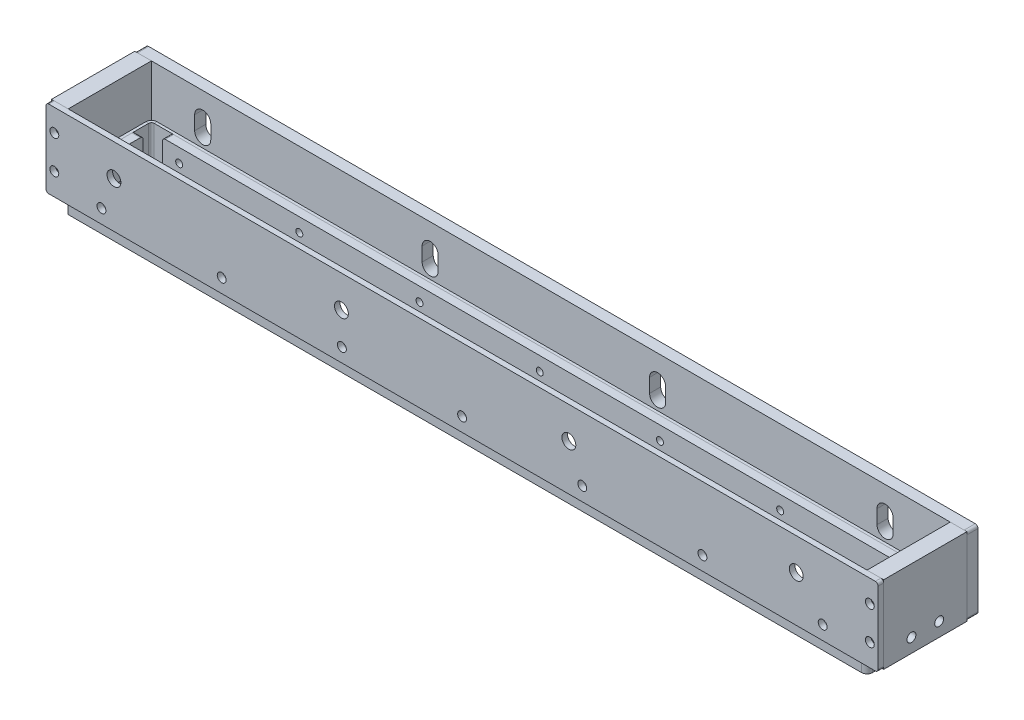
from build123d import *

# Parameters (mm, degrees)
SKETCH1_W                     = 300
SKETCH1_H                     = 36
SKETCH1_W_2                   = 288
SKETCH1_H_2                   = 30
BOSS_EXTRUDE1_DEPTH           = 28
M5_START                      = -19
M5_CLEARANCE_SLOT1_DEPTH      = 4
SPLIT2_START                  = -150
SPLIT2_OUTLINE_W              = 28
SPLIT2_OUTLINE_H              = 2
SPLIT2_DEPTH                  = 300
SPLIT2_START_2                = 15
SPLIT2_2_OUTLINE_W            = 300
SPLIT2_2_OUTLINE_H            = 28
SPLIT2_2_DEPTH                = 2
SPLIT2_START_3                = -15
SPLIT2_3_OUTLINE_W            = 6
SPLIT2_3_OUTLINE_H            = 28
SPLIT2_3_DEPTH                = 30
SPLIT2_4_OUTLINE_W            = 6
SPLIT2_4_OUTLINE_H            = 30
SPLIT2_4_DEPTH                = 28
SKETCH5_W                     = 1.6
SKETCH5_H                     = 36
M3_CLEARANCE_HOLE1_AT_2_COUNT = 2
M3_CLEARANCE_HOLE1_AT_2_PITCH = 12
SKETCH7_W                     = 1.25
SKETCH7_H                     = 36
M3_TAPPED_HOLE1_AT_2_COUNT    = 2
M3_TAPPED_HOLE1_AT_2_PITCH    = 12
MIRROR1_START                 = -19
MIRROR1_OUTLINE_R             = 1.25
MIRROR1_DEPTH                 = 36
MIRROR1_2_OUTLINE_R           = 1.6
MIRROR1_2_OUTLINE_R_2         = 1.25
MIRROR1_2_DEPTH               = 4
MIRROR1_START_2               = 15
MIRROR1_3_OUTLINE_R           = 1.6
MIRROR1_3_OUTLINE_R_2         = 1.25
MIRROR1_3_DEPTH               = 2
BOSS_EXTRUDE3_DEPTH           = 10
BOSS_EXTRUDE3_DEPTH_BACK      = 5
SKETCH8_W                     = 272
SKETCH8_H                     = 10
BOSS_EXTRUDE2_DEPTH           = 3
SKETCH10_W                    = 1.6
SKETCH10_H                    = 36
LPATTERN4_COUNT               = 4
LPATTERN4_PITCH               = 43.333333333
FILLET4_R                     = 1
MIRROR2_COPY_1_SKETCH_W       = 1.6
MIRROR2_COPY_1_SKETCH_H       = 36
MIRROR2_COPY_2_SKETCH_W       = 1.6
MIRROR2_COPY_2_SKETCH_H       = 36
MIRROR2_COPY_3_SKETCH_W       = 1.6
MIRROR2_COPY_3_SKETCH_H       = 36
SKETCH13_W                    = 1.25
SKETCH13_H                    = 36
M3_TAPPED_HOLE2_AT_2_COUNT    = 2
M3_TAPPED_HOLE2_AT_2_PITCH    = 43.333333333
M3_TAPPED_HOLE2_AT_3_COUNT    = 2
M3_TAPPED_HOLE2_AT_3_PITCH    = 86.666666667
M3_TAPPED_HOLE2_AT_4_COUNT    = 2
M3_TAPPED_HOLE2_AT_4_PITCH    = 130
M3_TAPPED_HOLE2_AT_5_COUNT    = 2
M3_TAPPED_HOLE2_AT_5_PITCH    = 43.333333333
M3_TAPPED_HOLE2_AT_6_COUNT    = 2
M3_TAPPED_HOLE2_AT_6_PITCH    = 86.666666667
M3_TAPPED_HOLE2_AT_7_COUNT    = 2
M3_TAPPED_HOLE2_AT_7_PITCH    = 130
SKETCH14_W                    = 16
SKETCH14_H                    = 10
BOSS_EXTRUDE4_DEPTH           = 3
SKETCH16_W                    = 1.25
SKETCH16_H                    = 300
M3_TAPPED_HOLE3_AT_2_COUNT    = 2
M3_TAPPED_HOLE3_AT_2_PITCH    = 10
SKETCH19_W                    = 1.6
SKETCH19_H                    = 300
M3_CLEARANCE_HOLE3_AT_2_COUNT = 2
M3_CLEARANCE_HOLE3_AT_2_PITCH = 10
FILLET5_R                     = 1
SKETCH21_R                    = 2.5
CUT_EXTRUDE1_DEPTH            = 10
LPATTERN5_COUNT               = 4
LPATTERN5_PITCH               = 82
FILLET6_R                     = 1
FILLET7_R                     = 1
CONVERT_SOLID1_START          = -5
CONVERT_SOLID1_DEPTH          = 15
CONVERT_SOLID1_2_DEPTH        = 15


# Read off the part's stored shape, not the designer's step: M5 Clearance Slot1, Split1, Split2, Mirror1, Convert-Solid1
with BuildPart() as part:
    # Sketch1 → Boss-Extrude1 (new body)
    with BuildSketch(Plane(origin=(0, 0, 0), x_dir=(1, 0, 0), z_dir=(0, 1, 0))):
        with Locations((0, 1)):
            Rectangle(SKETCH1_W, SKETCH1_H)
        Rectangle(SKETCH1_W_2, SKETCH1_H_2, mode=Mode.SUBTRACT)
    extrude(amount=BOSS_EXTRUDE1_DEPTH)

    # M5 Clearance Slot1 outline → M5 Clearance Slot1 (cut)
    with BuildSketch(Plane.XY.offset(M5_START)):
        with BuildLine():
            Line((123.4, 13.999994255), (123.4, 18.999994255))
            ThreePointArc((123.4, 18.999994255), (120.5, 21.899994255), (117.6, 18.999994255))
            Line((117.6, 18.999994255), (117.6, 13.999994255))
            ThreePointArc((117.6, 13.999994255), (120.5, 11.099994255), (123.4, 13.999994255))
        make_face()
        with BuildLine():
            Line((41.4, 13.999994255), (41.4, 18.999994255))
            ThreePointArc((41.4, 18.999994255), (38.5, 21.899994255), (35.6, 18.999994255))
            Line((35.6, 18.999994255), (35.6, 13.999994255))
            ThreePointArc((35.6, 13.999994255), (38.5, 11.099994255), (41.4, 13.999994255))
        make_face()
        with BuildLine():
            Line((-40.6, 13.999994255), (-40.6, 18.999994255))
            ThreePointArc((-40.6, 18.999994255), (-43.5, 21.899994255), (-46.4, 18.999994255))
            Line((-46.4, 18.999994255), (-46.4, 13.999994255))
            ThreePointArc((-46.4, 13.999994255), (-43.5, 11.099994255), (-40.6, 13.999994255))
        make_face()
        with BuildLine():
            Line((-122.6, 13.999994255), (-122.6, 18.999994255))
            ThreePointArc((-122.6, 18.999994255), (-125.5, 21.899994255), (-128.4, 18.999994255))
            Line((-128.4, 18.999994255), (-128.4, 13.999994255))
            ThreePointArc((-128.4, 13.999994255), (-125.5, 11.099994255), (-122.6, 13.999994255))
        make_face()
    extrude(amount=M5_CLEARANCE_SLOT1_DEPTH, mode=Mode.SUBTRACT)


with BuildPart() as body_2:
    # Split1: the piece on the far side of the plane
    add(part.part)
    split(bisect_by=Plane.XY.offset(-15), keep=Keep.BOTTOM)


with BuildPart() as part_1:
    add(part.part)

    # Split1
    split(bisect_by=Plane.XY.offset(-15), keep=Keep.TOP)

    # Split2 2 outline → Split2 2 (cut)
    with BuildSketch(Plane.XY.offset(SPLIT2_START_2)):
        with Locations((0, 14)):
            Rectangle(SPLIT2_2_OUTLINE_W, SPLIT2_2_OUTLINE_H)
    extrude(amount=SPLIT2_2_DEPTH, mode=Mode.SUBTRACT)

    # Split2 3 outline → Split2 3 (cut)
    with BuildSketch(Plane.XY.offset(SPLIT2_START_3)):
        with Locations((-147, 14)):
            Rectangle(SPLIT2_3_OUTLINE_W, SPLIT2_3_OUTLINE_H)
    extrude(amount=SPLIT2_3_DEPTH, mode=Mode.SUBTRACT)

    # Sketch7 → M3 Tapped Hole1 (revolve, cut)
    with BuildSketch(Plane(origin=(147, 20, 17), x_dir=(0, -1, 0), z_dir=(1, 0, 0))):
        with Locations((0.625, 18)):
            Rectangle(SKETCH7_W, SKETCH7_H)
    m3_tapped_hole1 = revolve(axis=Axis((147, 20, 23.35), (0, 0, -1)), mode=Mode.SUBTRACT)

    # M3 Tapped Hole1 at 2: M3 Tapped Hole1 ×2
    with Locations(*[(0, -i * M3_TAPPED_HOLE1_AT_2_PITCH, 0) for i in range(1, M3_TAPPED_HOLE1_AT_2_COUNT)]):
        add(m3_tapped_hole1, mode=Mode.SUBTRACT)


with BuildPart() as body_3:
    # Split2 outline → Split2 (new body)
    with BuildSketch(Plane.YZ.offset(SPLIT2_START)):
        with Locations((14, 16)):
            Rectangle(SPLIT2_OUTLINE_W, SPLIT2_OUTLINE_H)
    extrude(amount=SPLIT2_DEPTH)


with BuildPart() as body_4:
    # Split2 4 outline → Split2 4 (new body)
    with BuildSketch(Plane(origin=(0, 0, 0), x_dir=(1, 0, 0), z_dir=(0, 1, 0))):
        with Locations((-147, 0)):
            Rectangle(SPLIT2_4_OUTLINE_W, SPLIT2_4_OUTLINE_H)
    extrude(amount=SPLIT2_4_DEPTH)


with BuildPart() as m3_clearance_hole1_tool:
    # Sketch5 → M3 Clearance Hole1 (revolve)
    with BuildSketch(Plane(origin=(147, 20, 17), x_dir=(0, -1, 0), z_dir=(1, 0, 0))):
        with Locations((0.8, 18)):
            Rectangle(SKETCH5_W, SKETCH5_H)
    m3_clearance_hole1 = revolve(axis=Axis((147, 20, 23.35), (0, 0, -1)))


with BuildPart() as body_2_1:
    add(body_2.part)

    # M3 Clearance Hole1: cut by m3_clearance_hole1_tool
    add(m3_clearance_hole1_tool.part, mode=Mode.SUBTRACT)


with BuildPart() as body_3_1:
    add(body_3.part)

    # M3 Clearance Hole1: cut by m3_clearance_hole1_tool
    add(m3_clearance_hole1_tool.part, mode=Mode.SUBTRACT)


with BuildPart() as m3_clearance_hole1_at_2_tool:
    # M3 Clearance Hole1 at 2: M3 Clearance Hole1 ×2
    with Locations(*[(0, -i * M3_CLEARANCE_HOLE1_AT_2_PITCH, 0) for i in range(1, M3_CLEARANCE_HOLE1_AT_2_COUNT)]):
        add(m3_clearance_hole1)


with BuildPart() as body_2_2:
    add(body_2_1.part)

    # M3 Clearance Hole1 at 2: cut by m3_clearance_hole1_at_2_tool
    add(m3_clearance_hole1_at_2_tool.part, mode=Mode.SUBTRACT)


with BuildPart() as body_3_2:
    add(body_3_1.part)

    # M3 Clearance Hole1 at 2: cut by m3_clearance_hole1_at_2_tool
    add(m3_clearance_hole1_at_2_tool.part, mode=Mode.SUBTRACT)


with BuildPart() as mirror1_tool:
    # Mirror1 outline → Mirror1 (new body)
    with BuildSketch(Plane.XY.offset(MIRROR1_START)):
        with Locations((-147, 20)):
            Circle(MIRROR1_OUTLINE_R)
        with Locations((-147, 8)):
            Circle(MIRROR1_OUTLINE_R)
    extrude(amount=MIRROR1_DEPTH)


with BuildPart() as body_2_3:
    add(body_2_2.part)

    # Mirror1: cut by mirror1_tool
    add(mirror1_tool.part, mode=Mode.SUBTRACT)

    # Mirror1 2 outline → Mirror1 2 (cut)
    # profile 1 of 2: a face of its own
    with BuildSketch(Plane.XY.offset(MIRROR1_START)):
        with Locations((-147, 20)):
            Circle(MIRROR1_2_OUTLINE_R)
        with Locations((-147, 20)):
            Circle(MIRROR1_2_OUTLINE_R_2, mode=Mode.SUBTRACT)
    # profile 2 of 2: a face of its own
    with BuildSketch(Plane.XY.offset(MIRROR1_START)):
        with Locations((-147, 8)):
            Circle(MIRROR1_2_OUTLINE_R)
        with Locations((-147, 8)):
            Circle(MIRROR1_2_OUTLINE_R_2, mode=Mode.SUBTRACT)
    extrude(amount=MIRROR1_2_DEPTH, mode=Mode.SUBTRACT)


with BuildPart() as body_3_3:
    add(body_3_2.part)

    # Mirror1: cut by mirror1_tool
    add(mirror1_tool.part, mode=Mode.SUBTRACT)

    # Mirror1 3 outline → Mirror1 3 (cut)
    # profile 1 of 2: a face of its own
    with BuildSketch(Plane.XY.offset(MIRROR1_START_2)):
        with Locations((-147, 20)):
            Circle(MIRROR1_3_OUTLINE_R)
        with Locations((-147, 20)):
            Circle(MIRROR1_3_OUTLINE_R_2, mode=Mode.SUBTRACT)
    # profile 2 of 2: a face of its own
    with BuildSketch(Plane.XY.offset(MIRROR1_START_2)):
        with Locations((-147, 8)):
            Circle(MIRROR1_3_OUTLINE_R)
        with Locations((-147, 8)):
            Circle(MIRROR1_3_OUTLINE_R_2, mode=Mode.SUBTRACT)
    extrude(amount=MIRROR1_3_DEPTH, mode=Mode.SUBTRACT)


with BuildPart() as body_4_1:
    add(body_4.part)

    # Mirror1: cut by mirror1_tool
    add(mirror1_tool.part, mode=Mode.SUBTRACT)


with BuildPart() as body_5:
    # Sketch11 → Boss-Extrude3 (new, two sides: drawn at the far end of the back side and taken through both)
    with BuildSketch(Plane(origin=(0, 0, 0), x_dir=(1, 0, 0), z_dir=(0, 1, 0)).offset(-BOSS_EXTRUDE3_DEPTH_BACK)):
        Polygon((-143, 14), (-143, -13), (-144, -13), (-144, 15), (144, 15), (144, -15), (-144, -15), (-144, -14), (-143, -14), (143, -14), (143, 14), align=None)
    extrude(amount=BOSS_EXTRUDE3_DEPTH + BOSS_EXTRUDE3_DEPTH_BACK)


with BuildPart() as body_6:
    # Sketch8 → Boss-Extrude2 (new body)
    with BuildSketch(Plane(origin=(0, 0, 14), x_dir=(-1, 0, 0), z_dir=(0, 0, -1))):
        with Locations((0, 5)):
            Rectangle(SKETCH8_W, SKETCH8_H)
    extrude(amount=BOSS_EXTRUDE2_DEPTH)

    # Fillet4
    fillet4_edges = [body_6.edges().sort_by_distance(p)[0] for p in [
        (-136, 0, 12.5),
        (136, 0, 12.5),
        (136, 10, 12.5),
        (-136, 10, 12.5),
    ]]
    fillet(fillet4_edges, radius=FILLET4_R)


with BuildPart() as m3_clearance_hole2_tool:
    # Sketch10 → M3 Clearance Hole2 (revolve)
    with BuildSketch(Plane(origin=(0, 5, 17), x_dir=(0, -1, 0), z_dir=(1, 0, 0))):
        with Locations((0.8, 18)):
            Rectangle(SKETCH10_W, SKETCH10_H)
    m3_clearance_hole2 = revolve(axis=Axis((0, 5, 23.35), (0, 0, -1)))


with BuildPart() as body_2_4:
    add(body_2_3.part)

    # M3 Clearance Hole2: cut by m3_clearance_hole2_tool
    add(m3_clearance_hole2_tool.part, mode=Mode.SUBTRACT)


with BuildPart() as body_3_4:
    add(body_3_3.part)

    # M3 Clearance Hole2: cut by m3_clearance_hole2_tool
    add(m3_clearance_hole2_tool.part, mode=Mode.SUBTRACT)


with BuildPart() as body_5_1:
    add(body_5.part)

    # M3 Clearance Hole2: cut by m3_clearance_hole2_tool
    add(m3_clearance_hole2_tool.part, mode=Mode.SUBTRACT)


with BuildPart() as lpattern4_tool:
    # LPattern4: M3 Clearance Hole2 ×4
    with Locations(*[(i * LPATTERN4_PITCH, 0, 0) for i in range(1, LPATTERN4_COUNT)]):
        add(m3_clearance_hole2)


with BuildPart() as body_2_5:
    add(body_2_4.part)

    # LPattern4: cut by lpattern4_tool
    add(lpattern4_tool.part, mode=Mode.SUBTRACT)


with BuildPart() as body_3_5:
    add(body_3_4.part)

    # LPattern4: cut by lpattern4_tool
    add(lpattern4_tool.part, mode=Mode.SUBTRACT)


with BuildPart() as body_5_2:
    add(body_5_1.part)

    # LPattern4: cut by lpattern4_tool
    add(lpattern4_tool.part, mode=Mode.SUBTRACT)


with BuildPart() as mirror2_copy_1_tool:
    # Mirror2 copy 1 sketch → Mirror2 copy 1 (revolve)
    with BuildSketch(Plane(origin=(-43.333333333, 5, 17), x_dir=(0, -1, 0), z_dir=(-1, 0, 0))):
        with Locations((0.8, -18)):
            Rectangle(MIRROR2_COPY_1_SKETCH_W, MIRROR2_COPY_1_SKETCH_H)
    revolve(axis=Axis((-43.333333333, 5, 23.35), (0, 0, 1)))


with BuildPart() as body_2_6:
    add(body_2_5.part)

    # Mirror2 copy 1: cut by mirror2_copy_1_tool
    add(mirror2_copy_1_tool.part, mode=Mode.SUBTRACT)


with BuildPart() as body_3_6:
    add(body_3_5.part)

    # Mirror2 copy 1: cut by mirror2_copy_1_tool
    add(mirror2_copy_1_tool.part, mode=Mode.SUBTRACT)


with BuildPart() as body_5_3:
    add(body_5_2.part)

    # Mirror2 copy 1: cut by mirror2_copy_1_tool
    add(mirror2_copy_1_tool.part, mode=Mode.SUBTRACT)


with BuildPart() as mirror2_copy_2_tool:
    # Mirror2 copy 2 sketch → Mirror2 copy 2 (revolve)
    with BuildSketch(Plane(origin=(-86.666666667, 5, 17), x_dir=(0, -1, 0), z_dir=(-1, 0, 0))):
        with Locations((0.8, -18)):
            Rectangle(MIRROR2_COPY_2_SKETCH_W, MIRROR2_COPY_2_SKETCH_H)
    revolve(axis=Axis((-86.666666667, 5, 23.35), (0, 0, 1)))


with BuildPart() as body_2_7:
    add(body_2_6.part)

    # Mirror2 copy 2: cut by mirror2_copy_2_tool
    add(mirror2_copy_2_tool.part, mode=Mode.SUBTRACT)


with BuildPart() as body_3_7:
    add(body_3_6.part)

    # Mirror2 copy 2: cut by mirror2_copy_2_tool
    add(mirror2_copy_2_tool.part, mode=Mode.SUBTRACT)


with BuildPart() as body_5_4:
    add(body_5_3.part)

    # Mirror2 copy 2: cut by mirror2_copy_2_tool
    add(mirror2_copy_2_tool.part, mode=Mode.SUBTRACT)


with BuildPart() as mirror2_copy_3_tool:
    # Mirror2 copy 3 sketch → Mirror2 copy 3 (revolve)
    with BuildSketch(Plane(origin=(-130, 5, 17), x_dir=(0, -1, 0), z_dir=(-1, 0, 0))):
        with Locations((0.8, -18)):
            Rectangle(MIRROR2_COPY_3_SKETCH_W, MIRROR2_COPY_3_SKETCH_H)
    revolve(axis=Axis((-130, 5, 23.35), (0, 0, 1)))


with BuildPart() as body_2_8:
    add(body_2_7.part)

    # Mirror2 copy 3: cut by mirror2_copy_3_tool
    add(mirror2_copy_3_tool.part, mode=Mode.SUBTRACT)

    # Fillet6
    fillet6_edges = [body_2_8.edges().sort_by_distance(p)[0] for p in [
        (150, 0, -17),
        (-150, 0, -17),
        (150, 28, -17),
        (-150, 28, -17),
    ]]
    fillet(fillet6_edges, radius=FILLET6_R)


with BuildPart() as body_3_8:
    add(body_3_7.part)

    # Mirror2 copy 3: cut by mirror2_copy_3_tool
    add(mirror2_copy_3_tool.part, mode=Mode.SUBTRACT)

    # Sketch21 → Cut-Extrude1 (cut)
    with BuildSketch(Plane.XY.offset(17)):
        with Locations((-125.5, 16.499994255)):
            Circle(SKETCH21_R)
    cut_extrude1 = extrude(amount=-CUT_EXTRUDE1_DEPTH, mode=Mode.SUBTRACT)

    # LPattern5: Cut-Extrude1 ×4
    with Locations(*[(i * LPATTERN5_PITCH, 0, 0) for i in range(1, LPATTERN5_COUNT)]):
        add(cut_extrude1, mode=Mode.SUBTRACT)

    # Fillet7
    fillet7_edges = [body_3_8.edges().sort_by_distance(p)[0] for p in [
        (150, 0, 16),
        (-150, 0, 16),
        (150, 28, 16),
        (-150, 28, 16),
    ]]
    fillet(fillet7_edges, radius=FILLET7_R)


with BuildPart() as body_5_5:
    add(body_5_4.part)

    # Mirror2 copy 3: cut by mirror2_copy_3_tool
    add(mirror2_copy_3_tool.part, mode=Mode.SUBTRACT)


with BuildPart() as body_7:
    # Mirror3: mirrored copy
    add(body_6.part.mirror(Plane.XY))


with BuildPart() as m3_tapped_hole2_tool:
    # Sketch13 → M3 Tapped Hole2 (revolve)
    with BuildSketch(Plane(origin=(0, 5, 17), x_dir=(0, -1, 0), z_dir=(1, 0, 0))):
        with Locations((0.625, 18)):
            Rectangle(SKETCH13_W, SKETCH13_H)
    m3_tapped_hole2 = revolve(axis=Axis((0, 5, 23.35), (0, 0, -1)))


with BuildPart() as body_6_1:
    add(body_6.part)

    # M3 Tapped Hole2: cut by m3_tapped_hole2_tool
    add(m3_tapped_hole2_tool.part, mode=Mode.SUBTRACT)


with BuildPart() as body_7_1:
    add(body_7.part)

    # M3 Tapped Hole2: cut by m3_tapped_hole2_tool
    add(m3_tapped_hole2_tool.part, mode=Mode.SUBTRACT)


with BuildPart() as m3_tapped_hole2_at_2_tool:
    # M3 Tapped Hole2 at 2: M3 Tapped Hole2 ×2
    with Locations(*[(i * M3_TAPPED_HOLE2_AT_2_PITCH, 0, 0) for i in range(1, M3_TAPPED_HOLE2_AT_2_COUNT)]):
        add(m3_tapped_hole2)


with BuildPart() as body_6_2:
    add(body_6_1.part)

    # M3 Tapped Hole2 at 2: cut by m3_tapped_hole2_at_2_tool
    add(m3_tapped_hole2_at_2_tool.part, mode=Mode.SUBTRACT)


with BuildPart() as body_7_2:
    add(body_7_1.part)

    # M3 Tapped Hole2 at 2: cut by m3_tapped_hole2_at_2_tool
    add(m3_tapped_hole2_at_2_tool.part, mode=Mode.SUBTRACT)


with BuildPart() as m3_tapped_hole2_at_3_tool:
    # M3 Tapped Hole2 at 3: M3 Tapped Hole2 ×2
    with Locations(*[(i * M3_TAPPED_HOLE2_AT_3_PITCH, 0, 0) for i in range(1, M3_TAPPED_HOLE2_AT_3_COUNT)]):
        add(m3_tapped_hole2)


with BuildPart() as body_6_3:
    add(body_6_2.part)

    # M3 Tapped Hole2 at 3: cut by m3_tapped_hole2_at_3_tool
    add(m3_tapped_hole2_at_3_tool.part, mode=Mode.SUBTRACT)


with BuildPart() as body_7_3:
    add(body_7_2.part)

    # M3 Tapped Hole2 at 3: cut by m3_tapped_hole2_at_3_tool
    add(m3_tapped_hole2_at_3_tool.part, mode=Mode.SUBTRACT)


with BuildPart() as m3_tapped_hole2_at_4_tool:
    # M3 Tapped Hole2 at 4: M3 Tapped Hole2 ×2
    with Locations(*[(i * M3_TAPPED_HOLE2_AT_4_PITCH, 0, 0) for i in range(1, M3_TAPPED_HOLE2_AT_4_COUNT)]):
        add(m3_tapped_hole2)


with BuildPart() as body_6_4:
    add(body_6_3.part)

    # M3 Tapped Hole2 at 4: cut by m3_tapped_hole2_at_4_tool
    add(m3_tapped_hole2_at_4_tool.part, mode=Mode.SUBTRACT)


with BuildPart() as body_7_4:
    add(body_7_3.part)

    # M3 Tapped Hole2 at 4: cut by m3_tapped_hole2_at_4_tool
    add(m3_tapped_hole2_at_4_tool.part, mode=Mode.SUBTRACT)


with BuildPart() as m3_tapped_hole2_at_5_tool:
    # M3 Tapped Hole2 at 5: M3 Tapped Hole2 ×2
    with Locations(*[(-i * M3_TAPPED_HOLE2_AT_5_PITCH, 0, 0) for i in range(1, M3_TAPPED_HOLE2_AT_5_COUNT)]):
        add(m3_tapped_hole2)


with BuildPart() as body_6_5:
    add(body_6_4.part)

    # M3 Tapped Hole2 at 5: cut by m3_tapped_hole2_at_5_tool
    add(m3_tapped_hole2_at_5_tool.part, mode=Mode.SUBTRACT)


with BuildPart() as body_7_5:
    add(body_7_4.part)

    # M3 Tapped Hole2 at 5: cut by m3_tapped_hole2_at_5_tool
    add(m3_tapped_hole2_at_5_tool.part, mode=Mode.SUBTRACT)


with BuildPart() as m3_tapped_hole2_at_6_tool:
    # M3 Tapped Hole2 at 6: M3 Tapped Hole2 ×2
    with Locations(*[(-i * M3_TAPPED_HOLE2_AT_6_PITCH, 0, 0) for i in range(1, M3_TAPPED_HOLE2_AT_6_COUNT)]):
        add(m3_tapped_hole2)


with BuildPart() as body_6_6:
    add(body_6_5.part)

    # M3 Tapped Hole2 at 6: cut by m3_tapped_hole2_at_6_tool
    add(m3_tapped_hole2_at_6_tool.part, mode=Mode.SUBTRACT)


with BuildPart() as body_7_6:
    add(body_7_5.part)

    # M3 Tapped Hole2 at 6: cut by m3_tapped_hole2_at_6_tool
    add(m3_tapped_hole2_at_6_tool.part, mode=Mode.SUBTRACT)


with BuildPart() as m3_tapped_hole2_at_7_tool:
    # M3 Tapped Hole2 at 7: M3 Tapped Hole2 ×2
    with Locations(*[(-i * M3_TAPPED_HOLE2_AT_7_PITCH, 0, 0) for i in range(1, M3_TAPPED_HOLE2_AT_7_COUNT)]):
        add(m3_tapped_hole2)


with BuildPart() as body_6_7:
    add(body_6_6.part)

    # M3 Tapped Hole2 at 7: cut by m3_tapped_hole2_at_7_tool
    add(m3_tapped_hole2_at_7_tool.part, mode=Mode.SUBTRACT)


with BuildPart() as body_7_7:
    add(body_7_6.part)

    # M3 Tapped Hole2 at 7: cut by m3_tapped_hole2_at_7_tool
    add(m3_tapped_hole2_at_7_tool.part, mode=Mode.SUBTRACT)


with BuildPart() as body_8:
    # Sketch14 → Boss-Extrude4 (new body)
    with BuildSketch(Plane.ZY.offset(-143)):
        with Locations((0, 5)):
            Rectangle(SKETCH14_W, SKETCH14_H)
    extrude(amount=BOSS_EXTRUDE4_DEPTH)

    # Sketch16 → M3 Tapped Hole3 (revolve, cut)
    with BuildSketch(Plane(origin=(150, 5, 5), x_dir=(0, 0, -1), z_dir=(0, 1, 0))):
        with Locations((0.625, 150)):
            Rectangle(SKETCH16_W, SKETCH16_H)
    m3_tapped_hole3 = revolve(axis=Axis((156.35, 5, 5), (-1, 0, 0)), mode=Mode.SUBTRACT)

    # M3 Tapped Hole3 at 2: M3 Tapped Hole3 ×2
    with Locations(*[(0, 0, -i * M3_TAPPED_HOLE3_AT_2_PITCH) for i in range(1, M3_TAPPED_HOLE3_AT_2_COUNT)]):
        add(m3_tapped_hole3, mode=Mode.SUBTRACT)

    # Fillet5
    fillet5_edges = [body_8.edges().sort_by_distance(p)[0] for p in [
        (141.5, 10, -8),
        (141.5, 10, 8),
        (141.5, 0, 8),
        (141.5, 0, -8),
    ]]
    fillet(fillet5_edges, radius=FILLET5_R)


with BuildPart() as m3_clearance_hole3_tool:
    # Sketch19 → M3 Clearance Hole3 (revolve)
    with BuildSketch(Plane(origin=(150, 5, 5), x_dir=(0, 0, -1), z_dir=(0, 1, 0))):
        with Locations((0.8, 150)):
            Rectangle(SKETCH19_W, SKETCH19_H)
    m3_clearance_hole3 = revolve(axis=Axis((156.35, 5, 5), (-1, 0, 0)))


with BuildPart() as part_2:
    add(part_1.part)

    # M3 Clearance Hole3: cut by m3_clearance_hole3_tool
    add(m3_clearance_hole3_tool.part, mode=Mode.SUBTRACT)


with BuildPart() as body_4_2:
    add(body_4_1.part)

    # M3 Clearance Hole3: cut by m3_clearance_hole3_tool
    add(m3_clearance_hole3_tool.part, mode=Mode.SUBTRACT)


with BuildPart() as body_5_6:
    add(body_5_5.part)

    # M3 Clearance Hole3: cut by m3_clearance_hole3_tool
    add(m3_clearance_hole3_tool.part, mode=Mode.SUBTRACT)


with BuildPart() as m3_clearance_hole3_at_2_tool:
    # M3 Clearance Hole3 at 2: M3 Clearance Hole3 ×2
    with Locations(*[(0, 0, -i * M3_CLEARANCE_HOLE3_AT_2_PITCH) for i in range(1, M3_CLEARANCE_HOLE3_AT_2_COUNT)]):
        add(m3_clearance_hole3)


with BuildPart() as body_4_3:
    add(body_4_2.part)

    # M3 Clearance Hole3 at 2: cut by m3_clearance_hole3_at_2_tool
    add(m3_clearance_hole3_at_2_tool.part, mode=Mode.SUBTRACT)


with BuildPart() as body_5_7:
    add(body_5_6.part)

    # M3 Clearance Hole3 at 2: cut by m3_clearance_hole3_at_2_tool
    add(m3_clearance_hole3_at_2_tool.part, mode=Mode.SUBTRACT)

    # Convert-Solid1 outline → Convert-Solid1 (cut)
    with BuildSketch(Plane(origin=(0, 0, 0), x_dir=(1, 0, 0), z_dir=(0, 1, 0)).offset(CONVERT_SOLID1_START)):
        with BuildLine():
            Line((144, -15), (144, -13))
            ThreePointArc((144, -13), (143.414213562, -14.414213562), (142, -15))
            Line((142, -15), (144, -15))
        make_face()
        with BuildLine():
            ThreePointArc((-144, 13), (-143.414213562, 14.414213562), (-142, 15))
            Line((-142, 15), (-144, 15))
            Line((-144, 15), (-144, 13))
        make_face()
        with BuildLine():
            ThreePointArc((142, 15), (143.414213562, 14.414213562), (144, 13))
            Line((144, 13), (144, 15))
            Line((144, 15), (142, 15))
        make_face()
    extrude(amount=CONVERT_SOLID1_DEPTH, mode=Mode.SUBTRACT)

    # Convert-Solid1 2 outline → Convert-Solid1 2 (add)
    with BuildSketch(Plane(origin=(0, 0, 0), x_dir=(1, 0, 0), z_dir=(0, 1, 0)).offset(CONVERT_SOLID1_START)):
        with BuildLine():
            Line((143, -14), (143, -13))
            ThreePointArc((143, -13), (142.707106781, -13.707106781), (142, -14))
            Line((142, -14), (143, -14))
        make_face()
        with BuildLine():
            ThreePointArc((-143, 13), (-142.707106781, 13.707106781), (-142, 14))
            Line((-142, 14), (-143, 14))
            Line((-143, 14), (-143, 13))
        make_face()
        with BuildLine():
            ThreePointArc((142, 14), (142.707106781, 13.707106781), (143, 13))
            Line((143, 13), (143, 14))
            Line((143, 14), (142, 14))
        make_face()
    extrude(amount=CONVERT_SOLID1_2_DEPTH)


with BuildPart() as part_3:
    add(part_2.part)

    # M3 Clearance Hole3 at 2: cut by m3_clearance_hole3_at_2_tool
    add(m3_clearance_hole3_at_2_tool.part, mode=Mode.SUBTRACT)


with BuildPart() as body_9:
    # Mirror4: mirrored copy
    add(body_8.part.mirror(Plane(origin=(0, 0, 0), x_dir=(0, 0, 1), z_dir=(1, 0, 0))))


solid = Compound([body_2_8.part, body_3_8.part, body_6_7.part, body_7_7.part, body_8.part, body_4_3.part, body_5_7.part, part_3.part, body_9.part])
